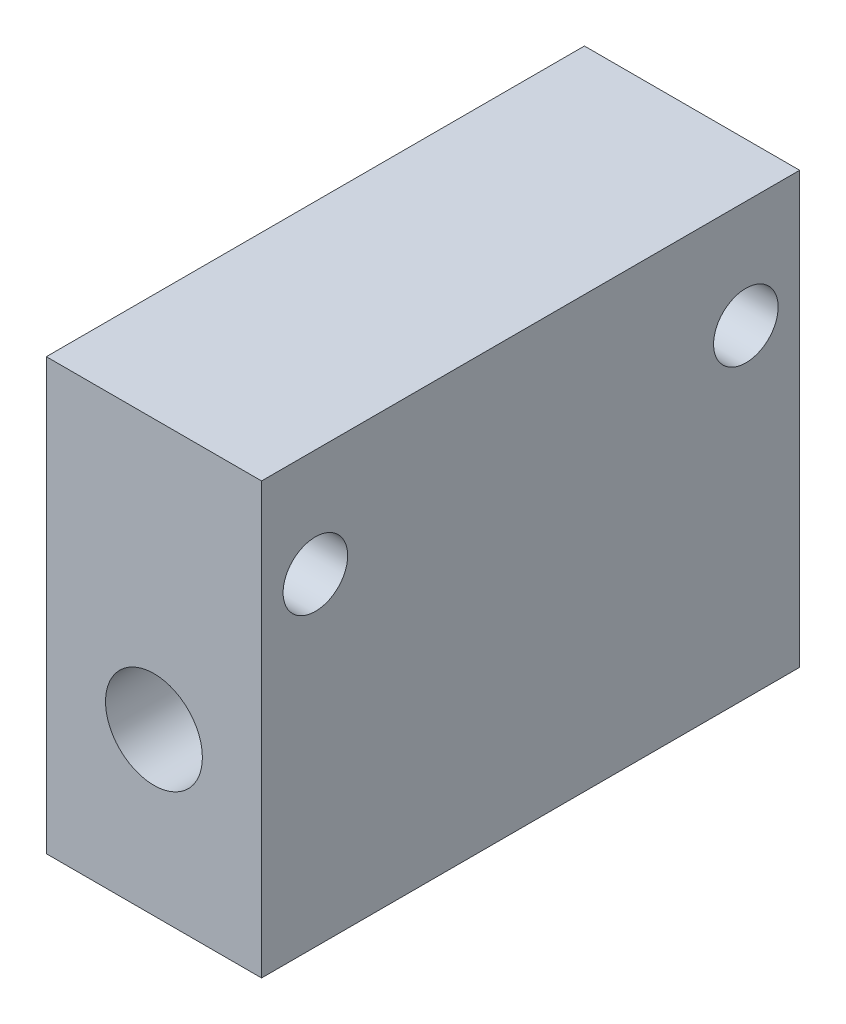
from build123d import *

# Parameters (mm, degrees)
SKETCH3_W           = 20
SKETCH3_H           = 50
BOSS_EXTRUDE1_DEPTH = 40
SKETCH4_R           = 4.5
CUT_EXTRUDE1_DEPTH  = 60
SKETCH5_R           = 3
CUT_EXTRUDE2_DEPTH  = 60


with BuildPart() as part:
    # Sketch3 → Boss-Extrude1 (new body)
    with BuildSketch(Plane(origin=(0, 0, 0), x_dir=(1, 0, 0), z_dir=(0, 1, 0))):
        with Locations((-3.806451613, -14.790322581)):
            Rectangle(SKETCH3_W, SKETCH3_H)
    extrude(amount=BOSS_EXTRUDE1_DEPTH)

    # Sketch4 → Cut-Extrude1 (cut)
    with BuildSketch(Plane.XY.offset(39.790322581)):
        with Locations((-3.806451613, 15)):
            Circle(SKETCH4_R)
    extrude(amount=-CUT_EXTRUDE1_DEPTH, mode=Mode.SUBTRACT)

    # Sketch5 → Cut-Extrude2 (cut)
    with BuildSketch(Plane(origin=(6.193548387, 0, 0), x_dir=(0, 0, -1), z_dir=(1, 0, 0))):
        with Locations((-34.790322581, 30)):
            Circle(SKETCH5_R)
        with Locations((5.209677419, 30)):
            Circle(SKETCH5_R)
    extrude(amount=-CUT_EXTRUDE2_DEPTH, mode=Mode.SUBTRACT)


solid = part.part
